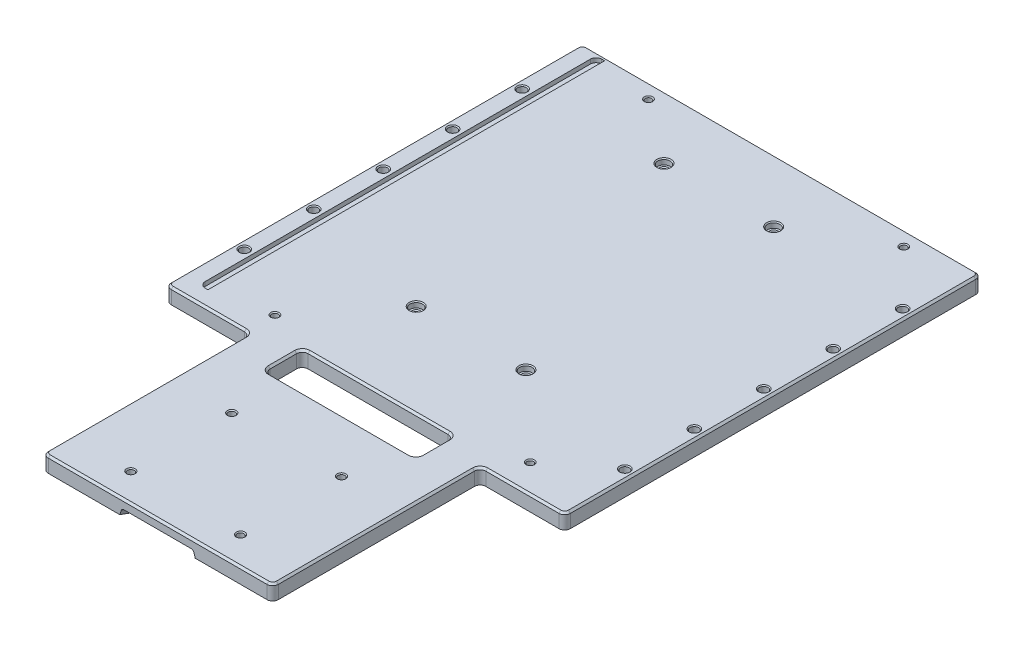
from build123d import *

# Parameters (mm, degrees)
SKETCH1_W                      = 211
SKETCH1_H                      = 330
BOSS_EXTRUDE1_DEPTH            = 8
CBORE_FOR_M3_SHCS1_AT_2_COUNT  = 2
CBORE_FOR_M3_SHCS1_AT_2_PITCH  = 58
CBORE_FOR_M3_SHCS1_AT_3_COUNT  = 2
CBORE_FOR_M3_SHCS1_AT_3_PITCH  = 131
CBORE_FOR_M3_SHCS1_AT_4_COUNT  = 2
CBORE_FOR_M3_SHCS1_AT_4_PITCH  = 143.265487819
M3_CLEARANCE_HOLE2_AT_2_COUNT  = 2
M3_CLEARANCE_HOLE2_AT_2_PITCH  = 58
M3_CLEARANCE_HOLE3_AT_2_COUNT  = 2
M3_CLEARANCE_HOLE3_AT_2_PITCH  = 58
SKETCH15_R                     = 2.165
CUT_EXTRUDE4_DEPTH             = 5
SKETCH6_W                      = 80
SKETCH6_H                      = 20
CUT_EXTRUDE1_DEPTH             = 197.008290641
SKETCH7_W                      = 44.7
SKETCH7_H                      = 109.7
CUT_EXTRUDE2_DEPTH             = 197.008290641
M4_CLEARANCE_HOLE1_AT_2_COUNT  = 2
M4_CLEARANCE_HOLE1_AT_2_PITCH  = 36.716666667
M4_CLEARANCE_HOLE1_AT_3_COUNT  = 2
M4_CLEARANCE_HOLE1_AT_3_PITCH  = 73.433333333
M4_CLEARANCE_HOLE1_AT_4_COUNT  = 2
M4_CLEARANCE_HOLE1_AT_4_PITCH  = 110.15
M4_CLEARANCE_HOLE1_AT_5_COUNT  = 2
M4_CLEARANCE_HOLE1_AT_5_PITCH  = 146.866666667
M4_CLEARANCE_HOLE1_AT_6_COUNT  = 2
M4_CLEARANCE_HOLE1_AT_6_PITCH  = 249.10089879
M4_CLEARANCE_HOLE1_AT_7_COUNT  = 2
M4_CLEARANCE_HOLE1_AT_7_PITCH  = 229.378426405
M4_CLEARANCE_HOLE1_AT_8_COUNT  = 2
M4_CLEARANCE_HOLE1_AT_8_PITCH  = 214.181919042
M4_CLEARANCE_HOLE1_AT_9_COUNT  = 2
M4_CLEARANCE_HOLE1_AT_9_PITCH  = 204.52274595
M4_CLEARANCE_HOLE1_AT_10_COUNT = 2
M4_CLEARANCE_HOLE1_AT_10_PITCH = 201.2
SKETCH12_R                     = 21.75
CUT_EXTRUDE3_DEPTH             = 3.33434991
CUT_EXTRUDE3_DRAFT             = -15
SKETCH17_W                     = 4.5
SKETCH17_H                     = 209.7
CUT_EXTRUDE5_DEPTH             = 2.25
FILLET1_R                      = 3
CHAMFER1_SIZE                  = 1
FILLET2_R                      = 1.5
CHAMFER2_SIZE                  = 0.5


# Read off the part's stored shape, not the designer's step: M3 Clearance Hole1
with BuildPart() as part:
    # Sketch1 → Boss-Extrude1 (new body)
    with BuildSketch(Plane(origin=(0, 0, 0), x_dir=(1, 0, 0), z_dir=(0, 1, 0))):
        Rectangle(SKETCH1_W, SKETCH1_H)
    extrude(amount=BOSS_EXTRUDE1_DEPTH)

    # M3 Clearance Hole1 outline → M3 Clearance Hole1 (revolve, cut)
    with BuildSketch(Plane(origin=(72.5, 0, 40.5), x_dir=(1, 0, 0), z_dir=(0, 0, 1))):
        Polygon((0, 0), (1.7, 0), (1.7, 7.5), (2.2, 8), (0, 8), align=None)
    revolve(axis=Axis((72.5, 0, 40.5), (0, 1, 0)), mode=Mode.SUBTRACT)

    # M3 Clearance Hole1 2 outline → M3 Clearance Hole1 2 (revolve, cut)
    with BuildSketch(Plane(origin=(-62.5, 0, 40.5), x_dir=(1, 0, 0), z_dir=(0, 0, 1))):
        Polygon((0, 0), (1.7, 0), (1.7, 7.5), (2.2, 8), (0, 8), align=None)
    revolve(axis=Axis((-62.5, 0, 40.5), (0, 1, 0)), mode=Mode.SUBTRACT)

    # M3 Clearance Hole1 3 outline → M3 Clearance Hole1 3 (revolve, cut)
    with BuildSketch(Plane(origin=(72.5, 0, -157), x_dir=(1, 0, 0), z_dir=(0, 0, 1))):
        Polygon((0, 0), (1.7, 0), (1.7, 7.5), (2.2, 8), (0, 8), align=None)
    revolve(axis=Axis((72.5, 0, -157), (0, 1, 0)), mode=Mode.SUBTRACT)

    # M3 Clearance Hole1 4 outline → M3 Clearance Hole1 4 (revolve, cut)
    with BuildSketch(Plane(origin=(-62.5, 0, -157), x_dir=(1, 0, 0), z_dir=(0, 0, 1))):
        Polygon((0, 0), (1.7, 0), (1.7, 7.5), (2.2, 8), (0, 8), align=None)
    revolve(axis=Axis((-62.5, 0, -157), (0, 1, 0)), mode=Mode.SUBTRACT)

    # Sketch5 → CBORE for M3 SHCS1 (revolve, cut)
    with BuildSketch(Plane(origin=(-29, 8, -131.7), x_dir=(0, 0, 1), z_dir=(1, 0, 0))):
        Polygon((0, 0), (0, 8), (2.2, 8), (1.7, 7.5), (1.7, 3.5), (2.2, 3), (3.25, 3), (3.25, 0.5), (3.75, 0), align=None)
    cbore_for_m3_shcs1 = revolve(axis=Axis((-29, 14.35, -131.7), (0, -1, 0)), mode=Mode.SUBTRACT)

    # CBORE for M3 SHCS1 at 2: CBORE for M3 SHCS1 ×2
    with Locations(*[(i * CBORE_FOR_M3_SHCS1_AT_2_PITCH, 0, 0) for i in range(1, CBORE_FOR_M3_SHCS1_AT_2_COUNT)]):
        add(cbore_for_m3_shcs1, mode=Mode.SUBTRACT)

    # CBORE for M3 SHCS1 at 3: CBORE for M3 SHCS1 ×2
    with Locations(*[(0, 0, i * CBORE_FOR_M3_SHCS1_AT_3_PITCH) for i in range(1, CBORE_FOR_M3_SHCS1_AT_3_COUNT)]):
        add(cbore_for_m3_shcs1, mode=Mode.SUBTRACT)

    # CBORE for M3 SHCS1 at 4: CBORE for M3 SHCS1 ×2
    with Locations(*[Vector(0.40484279140067003, 0, 0.9143863047153066) * (i * CBORE_FOR_M3_SHCS1_AT_4_PITCH) for i in range(1, CBORE_FOR_M3_SHCS1_AT_4_COUNT)]):
        add(cbore_for_m3_shcs1, mode=Mode.SUBTRACT)

    # Sketch14 → M3 Clearance Hole2 (revolve, cut)
    with BuildSketch(Plane(origin=(29, 8, 150.18), x_dir=(0, 0, 1), z_dir=(1, 0, 0))):
        Polygon((0, 0), (0, 8), (2.3, 8), (1.8, 7.5), (1.8, 0.5), (2.3, 0), align=None)
    m3_clearance_hole2 = revolve(axis=Axis((29, 14.35, 150.18), (0, -1, 0)), mode=Mode.SUBTRACT)

    # M3 Clearance Hole2 at 2: M3 Clearance Hole2 ×2
    with Locations(*[(-i * M3_CLEARANCE_HOLE2_AT_2_PITCH, 0, 0) for i in range(1, M3_CLEARANCE_HOLE2_AT_2_COUNT)]):
        add(m3_clearance_hole2, mode=Mode.SUBTRACT)

    # Sketch19 → M3 Clearance Hole3 (revolve, cut)
    with BuildSketch(Plane(origin=(-29, 0, 96.82), x_dir=(0, 0, -1), z_dir=(1, 0, 0))):
        Polygon((0, 0), (0, 8), (2.3, 8), (1.8, 7.5), (1.8, 0), align=None)
    m3_clearance_hole3 = revolve(axis=Axis((-29, -6.35, 96.82), (0, 1, 0)), mode=Mode.SUBTRACT)

    # M3 Clearance Hole3 at 2: M3 Clearance Hole3 ×2
    with Locations(*[(i * M3_CLEARANCE_HOLE3_AT_2_PITCH, 0, 0) for i in range(1, M3_CLEARANCE_HOLE3_AT_2_COUNT)]):
        add(m3_clearance_hole3, mode=Mode.SUBTRACT)

    # Sketch15 → Cut-Extrude4 (cut)
    with BuildSketch(Plane.XZ):
        with Locations(Location((72.5, 40.5, 0), (0, 0, 270))):
            Circle(SKETCH15_R)
        with Locations(Location((-62.5, 40.5, 0), (0, 0, 270))):
            Circle(SKETCH15_R)
        with Locations(Location((72.5, -157, 0), (0, 0, 270))):
            Circle(SKETCH15_R)
        with Locations(Location((-62.5, -157, 0), (0, 0, 270))):
            Circle(SKETCH15_R)
        with Locations(Location((-29, 96.82, 0), (0, 0, 270))):
            Circle(SKETCH15_R)
        with Locations(Location((29, 96.82, 0), (0, 0, 270))):
            Circle(SKETCH15_R)
    extrude(amount=-CUT_EXTRUDE4_DEPTH, mode=Mode.SUBTRACT)

    # Sketch6 → Cut-Extrude1 (cut, through all)
    with BuildSketch(Plane(origin=(0, 8, 0), x_dir=(1, 0, 0), z_dir=(0, 1, 0))):
        with Locations((0, -58.5)):
            Rectangle(SKETCH6_W, SKETCH6_H)
    extrude(amount=-CUT_EXTRUDE1_DEPTH, mode=Mode.SUBTRACT)

    # Sketch7 → Cut-Extrude2 (cut, through all)
    with BuildSketch(Plane(origin=(0, 8, 0), x_dir=(1, 0, 0), z_dir=(0, 1, 0))):
        with Locations((-83.15, -110.15)):
            Rectangle(SKETCH7_W, SKETCH7_H)
        with Locations((83.15, -110.15)):
            Rectangle(SKETCH7_W, SKETCH7_H)
    extrude(amount=-CUT_EXTRUDE2_DEPTH, mode=Mode.SUBTRACT)

    # Sketch9 → M4 Clearance Hole1 (revolve, cut)
    with BuildSketch(Plane(origin=(-100.6, 8, -128.283333333), x_dir=(0, 0, 1), z_dir=(1, 0, 0))):
        Polygon((0, 0), (0, 8), (2.75, 8), (2.25, 7.5), (2.25, 0.5), (2.75, 0), align=None)
    m4_clearance_hole1 = revolve(axis=Axis((-100.6, 14.35, -128.283333333), (0, -1, 0)), mode=Mode.SUBTRACT)

    # M4 Clearance Hole1 at 2: M4 Clearance Hole1 ×2
    with Locations(*[(0, 0, i * M4_CLEARANCE_HOLE1_AT_2_PITCH) for i in range(1, M4_CLEARANCE_HOLE1_AT_2_COUNT)]):
        add(m4_clearance_hole1, mode=Mode.SUBTRACT)

    # M4 Clearance Hole1 at 3: M4 Clearance Hole1 ×2
    with Locations(*[(0, 0, i * M4_CLEARANCE_HOLE1_AT_3_PITCH) for i in range(1, M4_CLEARANCE_HOLE1_AT_3_COUNT)]):
        add(m4_clearance_hole1, mode=Mode.SUBTRACT)

    # M4 Clearance Hole1 at 4: M4 Clearance Hole1 ×2
    with Locations(*[(0, 0, i * M4_CLEARANCE_HOLE1_AT_4_PITCH) for i in range(1, M4_CLEARANCE_HOLE1_AT_4_COUNT)]):
        add(m4_clearance_hole1, mode=Mode.SUBTRACT)

    # M4 Clearance Hole1 at 5: M4 Clearance Hole1 ×2
    with Locations(*[(0, 0, i * M4_CLEARANCE_HOLE1_AT_5_PITCH) for i in range(1, M4_CLEARANCE_HOLE1_AT_5_COUNT)]):
        add(m4_clearance_hole1, mode=Mode.SUBTRACT)

    # M4 Clearance Hole1 at 6: M4 Clearance Hole1 ×2
    with Locations(*[Vector(0.8077048335741067, 0, 0.5895870604253665) * (i * M4_CLEARANCE_HOLE1_AT_6_PITCH) for i in range(1, M4_CLEARANCE_HOLE1_AT_6_COUNT)]):
        add(m4_clearance_hole1, mode=Mode.SUBTRACT)

    # M4 Clearance Hole1 at 7: M4 Clearance Hole1 ×2
    with Locations(*[Vector(0.8771531096164119, 0, 0.48021081025968065) * (i * M4_CLEARANCE_HOLE1_AT_7_PITCH) for i in range(1, M4_CLEARANCE_HOLE1_AT_7_COUNT)]):
        add(m4_clearance_hole1, mode=Mode.SUBTRACT)

    # M4 Clearance Hole1 at 8: M4 Clearance Hole1 ×2
    with Locations(*[Vector(0.939388352201186, 0, 0.3428549602218707) * (i * M4_CLEARANCE_HOLE1_AT_8_PITCH) for i in range(1, M4_CLEARANCE_HOLE1_AT_8_COUNT)]):
        add(m4_clearance_hole1, mode=Mode.SUBTRACT)

    # M4 Clearance Hole1 at 9: M4 Clearance Hole1 ×2
    with Locations(*[Vector(0.9837536605769409, 0, 0.17952363438129534) * (i * M4_CLEARANCE_HOLE1_AT_9_PITCH) for i in range(1, M4_CLEARANCE_HOLE1_AT_9_COUNT)]):
        add(m4_clearance_hole1, mode=Mode.SUBTRACT)

    # M4 Clearance Hole1 at 10: M4 Clearance Hole1 ×2
    with Locations(*[(i * M4_CLEARANCE_HOLE1_AT_10_PITCH, 0, 0) for i in range(1, M4_CLEARANCE_HOLE1_AT_10_COUNT)]):
        add(m4_clearance_hole1, mode=Mode.SUBTRACT)


with BuildPart() as cut_extrude3_tool:
    # Sketch12 → Cut-Extrude3 (with draft: the straight prism first)
    with BuildSketch(Plane.XZ):
        with Locations((-0.052607466, 173.76846104)):
            Circle(SKETCH12_R)
    extrude(amount=-CUT_EXTRUDE3_DEPTH)
    # Cut-Extrude3: the draft: its side faces are tilted about the plane it starts from
    cut_extrude3_sides = [cut_extrude3_tool.faces().sort_by_distance(p)[0] for p in [
        (-21.802607466, 1.667174955, 173.76846104),
    ]]
    draft(cut_extrude3_sides, Plane.XZ, CUT_EXTRUDE3_DRAFT)


with BuildPart() as part_1:
    add(part.part)

    # Cut-Extrude3: cut by cut_extrude3_tool
    add(cut_extrude3_tool.part, mode=Mode.SUBTRACT)

    # Sketch17 → Cut-Extrude5 (cut)
    with BuildSketch(Plane(origin=(0, 8, 0), x_dir=(1, 0, 0), z_dir=(0, 1, 0))):
        with Locations((-93.95, 58.15)):
            Rectangle(SKETCH17_W, SKETCH17_H)
    extrude(amount=-CUT_EXTRUDE5_DEPTH, mode=Mode.SUBTRACT)

    # Fillet1
    fillet1_edges = [part_1.edges().sort_by_distance(p)[0] for p in [
        (-40, 4, 68.5),
        (-40, 4, 48.5),
        (40, 4, 48.5),
        (40, 4, 68.5),
        (-105.5, 4, 55.3),
        (-60.8, 4, 55.3),
        (-60.8, 4, 165),
        (105.5, 4, 55.3),
        (60.8, 4, 165),
        (60.8, 4, 55.3),
        (-96.2, 6.875, 46.7),
        (-96.2, 6.875, -163),
        (-105.5, 4, -165),
        (105.5, 4, -165),
    ]]
    fillet(fillet1_edges, radius=FILLET1_R)

    # Chamfer1
    chamfer1_edges = [part_1.edges().sort_by_distance(p)[0] for p in [
        (0, 8, 165),
        (-83.15, 8, 55.3),
        (-60.8, 8, 110.15),
        (60.8, 8, 110.15),
        (83.15, 8, 55.3),
        (105.5, 8, -54.85),
        (0, 8, -165),
        (-105.5, 8, -54.85),
        (-40, 8, 58.5),
        (0, 8, 48.5),
        (40, 8, 58.5),
        (0, 8, 68.5),
        (104.621320344, 8, -164.121320344),
        (-104.621320344, 8, -164.121320344),
        (-104.621320344, 8, 54.421320344),
        (-59.921320344, 8, 164.121320344),
        (104.621320344, 8, 54.421320344),
        (59.921320344, 8, 164.121320344),
        (61.678679656, 8, 56.178679656),
        (-61.678679656, 8, 56.178679656),
        (39.121320344, 8, 67.621320344),
        (-39.121320344, 8, 67.621320344),
        (-39.121320344, 8, 49.378679656),
        (39.121320344, 8, 49.378679656),
    ]]
    chamfer(chamfer1_edges, length=CHAMFER1_SIZE)

    # Fillet2
    fillet2_edges = [part_1.edges().sort_by_distance(p)[0] for p in [
        (-0.052607466, 3.33434991, 152.911897406),
    ]]
    fillet(fillet2_edges, radius=FILLET2_R)

    # Chamfer2
    chamfer2_edges = [part_1.edges().sort_by_distance(p)[0] for p in [
        (-29, 0, 98.985),
        (-62.5, 0, -154.835),
        (72.5, 0, -154.835),
        (-62.5, 0, 42.665),
        (29, 0, 98.985),
        (72.5, 0, 42.665),
    ]]
    chamfer(chamfer2_edges, length=CHAMFER2_SIZE)


solid = part_1.part
